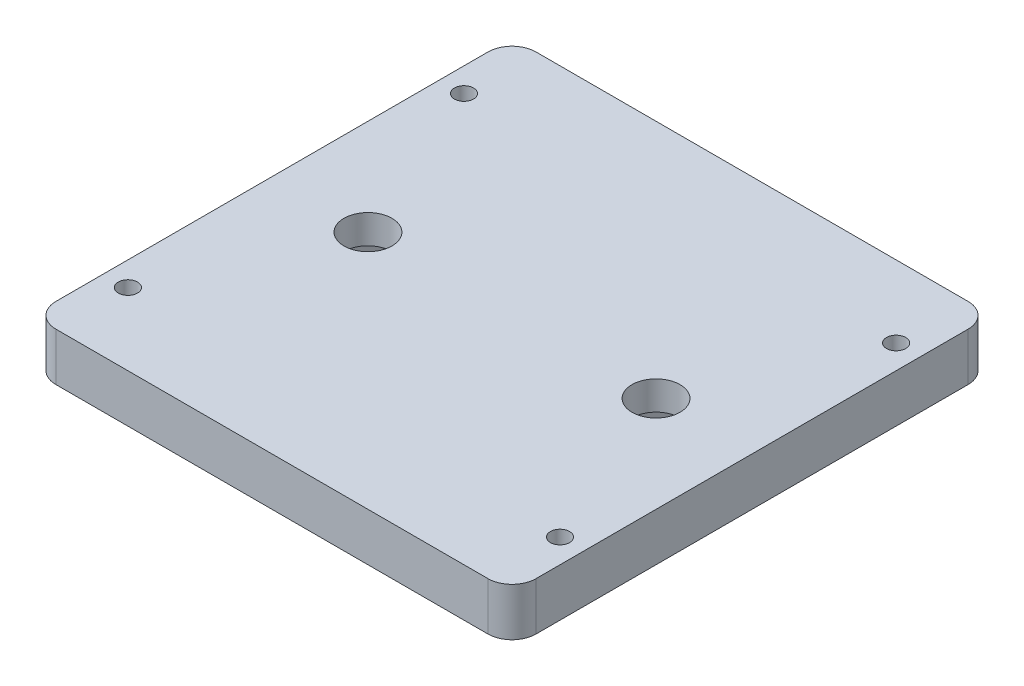
from build123d import *

# Parameters (mm, degrees)
SKETCH1_W           = 100
SKETCH1_H           = 100
BOSS_EXTRUDE1_DEPTH = 10
SKETCH2_R           = 2
CUT_EXTRUDE1_DEPTH  = 72.414284285
CUT_EXTRUDE2_DEPTH  = 4
SKETCH4_R           = 5
CUT_EXTRUDE3_DEPTH  = 71.964779997
SKETCH5_R           = 7.65
SKETCH5_R_2         = 5.15
EXTRUDE_THIN1_DEPTH = 20
RIB6_START          = -1.5
RIB6_DEPTH          = 3
CIRPATTERN2_COUNT   = 4
FILLET1_R           = 5


with BuildPart() as part:
    # Sketch1 → Boss-Extrude1 (new body)
    with BuildSketch(Plane(origin=(0, 0, 0), x_dir=(1, 0, 0), z_dir=(0, 1, 0))):
        Rectangle(SKETCH1_W, SKETCH1_H)
    extrude(amount=BOSS_EXTRUDE1_DEPTH)

    # Sketch2 → Cut-Extrude1 (cut, through all)
    with BuildSketch(Plane(origin=(0, 10, 0), x_dir=(1, 0, 0), z_dir=(0, 1, 0))):
        with Locations(Location((-45, 35, 0), (0, 0, 270))):
            Circle(SKETCH2_R)
        with Locations(Location((45, 35, 0), (0, 0, 270))):
            Circle(SKETCH2_R)
        with Locations(Location((45, -35, 0), (0, 0, 270))):
            Circle(SKETCH2_R)
        with Locations(Location((-45, -35, 0), (0, 0, 270))):
            Circle(SKETCH2_R)
    extrude(amount=-CUT_EXTRUDE1_DEPTH, mode=Mode.SUBTRACT)

    # Sketch3 → Cut-Extrude2 (cut)
    with BuildSketch(Plane.XZ):
        Polygon((-20.762395693, 0), (-25.381197846, 8), (-34.618802154, 8), (-39.237604307, 0), (-34.618802154, -8), (-25.381197846, -8), align=None)
        Polygon((25.381197846, -8), (20.762395693, 0), (25.381197846, 8), (34.618802154, 8), (39.237604307, 0), (34.618802154, -8), align=None)
    extrude(amount=-CUT_EXTRUDE2_DEPTH, mode=Mode.SUBTRACT)

    # Sketch4 → Cut-Extrude3 (cut, through all)
    with BuildSketch(Plane.XZ.offset(-4)):
        with Locations(Location((-30, 0, 0), (0, 0, 270))):
            Circle(SKETCH4_R)
        with Locations(Location((30, 0, 0), (0, 0, 90))):
            Circle(SKETCH4_R)
    extrude(amount=-CUT_EXTRUDE3_DEPTH, mode=Mode.SUBTRACT)

    # Sketch5 → Extrude-Thin1 (add)
    with BuildSketch(Plane.XZ):
        Circle(SKETCH5_R)
        Circle(SKETCH5_R_2, mode=Mode.SUBTRACT)
    extrude(amount=EXTRUDE_THIN1_DEPTH)

    # Rib6: read off the stored shape, not the designer's step
    # Rib6 outline → Rib6 (add)
    with BuildSketch(Plane(origin=(0, 0, 0), x_dir=(0.7071067811865461, 0, -0.7071067811865489), z_dir=(0.7071067811865489, 0, 0.7071067811865461)).offset(RIB6_START)):
        Polygon((7.65, -20), (22.65, 0), (7.50149985, 0), (7.50149985, -20), align=None)
    rib6 = extrude(amount=RIB6_DEPTH)

    # CirPattern2: Rib6 ×4 about axis
    cirpattern2_axis = Axis((0, 0, 0), (0, 1, 0))
    for i in range(1, CIRPATTERN2_COUNT):
        add(rib6.rotate(cirpattern2_axis, i * 360 / CIRPATTERN2_COUNT))

    # Fillet1
    fillet1_edges = [part.edges().sort_by_distance(p)[0] for p in [
        (50, 5, 50),
        (-50, 5, 50),
        (-50, 5, -50),
        (50, 5, -50),
    ]]
    fillet(fillet1_edges, radius=FILLET1_R)


solid = part.part
